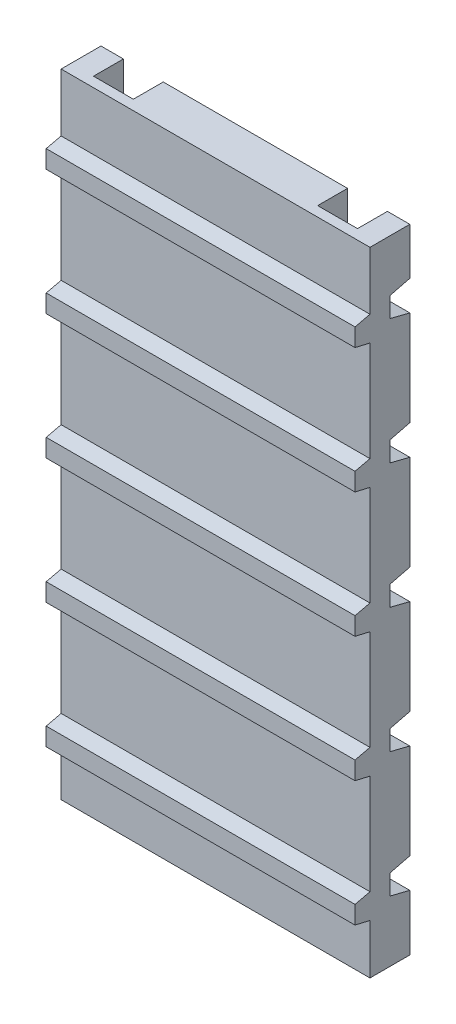
from build123d import *

# Parameters (mm, degrees)
SKETCH2_W                  = 34
SKETCH2_H                  = 13.32
BOSS_EXTRUDE1_DEPTH        = 4
SKETCH3_W                  = 17
SKETCH3_H                  = 7
CUT_EXTRUDE1_DEPTH         = 3
SKETCH4_W                  = 4
SKETCH4_H                  = 13.32
CUT_EXTRUDE3_DEPTH         = 3
CUT_EXTRUDE4_DEPTH         = 4
CUT_EXTRUDE5_DEPTH         = 4
BOSS_EXTRUDE2_DEPTH        = 34
SKETCH9_W                  = 1.5
SKETCH9_H                  = 13.32
CUT_EXTRUDE6_DEPTH         = 10
CRVPATTERN11_START         = -8.5
CRVPATTERN11_OUTLINE_W     = 0.77
CRVPATTERN11_OUTLINE_H     = 3
CRVPATTERN11_DEPTH         = 17
CRVPATTERN11_START_2       = -9.25
CRVPATTERN11_2_DEPTH       = 18.5
CRVPATTERN11_START_3       = -15.5
CRVPATTERN11_3_DEPTH       = 31
CRVPATTERN11_START_4       = 13.25
CRVPATTERN11_4_DEPTH       = 2.25
CRVPATTERN11_5_DEPTH       = 2.25
CRVPATTERN11_6_OUTLINE_W   = 7
CRVPATTERN11_6_OUTLINE_H   = 3
CRVPATTERN11_6_OUTLINE_W_2 = 6.23
CRVPATTERN11_6_DEPTH       = 0.75
CRVPATTERN11_START_5       = 8.5
CRVPATTERN11_7_OUTLINE_W   = 7
CRVPATTERN11_7_OUTLINE_H   = 3
CRVPATTERN11_7_OUTLINE_W_2 = 6.23
CRVPATTERN11_7_DEPTH       = 0.75


with BuildPart() as part:
    # Sketch2 → Boss-Extrude1 (new body)
    with BuildSketch(Plane.XY):
        with Locations((0, 6.66)):
            Rectangle(SKETCH2_W, SKETCH2_H)
    extrude(amount=BOSS_EXTRUDE1_DEPTH)

    # Sketch3 → Cut-Extrude1 (cut)
    with BuildSketch(Plane(origin=(0, 0, 0), x_dir=(-1, 0, 0), z_dir=(0, 0, -1))):
        with Locations((0, 3.5)):
            Rectangle(SKETCH3_W, SKETCH3_H)
    extrude(amount=-CUT_EXTRUDE1_DEPTH, mode=Mode.SUBTRACT)

    # Sketch4 → Cut-Extrude3 (cut)
    with BuildSketch(Plane(origin=(0, 0, 0), x_dir=(-1, 0, 0), z_dir=(0, 0, -1))):
        with Locations((-11.25, 6.66)):
            Rectangle(SKETCH4_W, SKETCH4_H)
        with Locations((11.25, 6.66)):
            Rectangle(SKETCH4_W, SKETCH4_H)
    extrude(amount=-CUT_EXTRUDE3_DEPTH, mode=Mode.SUBTRACT)

    # Sketch6 → Cut-Extrude4 (cut)
    with BuildSketch(Plane(origin=(17, 0, 0), x_dir=(0, 0, -1), z_dir=(1, 0, 0))):
        Polygon((0, 8.62), (0, 5.62), (-2, 6.12), (-2, 8.12), align=None)
    extrude(amount=-CUT_EXTRUDE4_DEPTH, mode=Mode.SUBTRACT)

    # Sketch7 → Cut-Extrude5 (cut)
    with BuildSketch(Plane.ZY.offset(17)):
        Polygon((0, 5.616283946), (0, 8.62), (2, 8.117101335), (2, 6.119182611), align=None)
    extrude(amount=-CUT_EXTRUDE5_DEPTH, mode=Mode.SUBTRACT)

    # Sketch8 → Boss-Extrude2 (add)
    with BuildSketch(Plane.ZY.offset(17)):
        Polygon((4, 5), (4, 7.5), (5.5, 7.15), (5.5, 5.35), align=None)
    extrude(amount=-BOSS_EXTRUDE2_DEPTH)

    # Sketch9 → Cut-Extrude6 (cut)
    with BuildSketch(Plane(origin=(0, 0, 0), x_dir=(-1, 0, 0), z_dir=(0, 0, -1))):
        with Locations((-16.25, 6.66)):
            Rectangle(SKETCH9_W, SKETCH9_H)
        with Locations((16.25, 6.66)):
            Rectangle(SKETCH9_W, SKETCH9_H)
    extrude(amount=-CUT_EXTRUDE6_DEPTH, mode=Mode.SUBTRACT)

    # CrvPattern11: read off the stored shape, not the designer's step
    # CrvPattern11 outline → CrvPattern11 (cut)
    with BuildSketch(Plane.YZ.offset(CRVPATTERN11_START)):
        with Locations((12.935, 1.5)):
            Rectangle(CRVPATTERN11_OUTLINE_W, CRVPATTERN11_OUTLINE_H)
    extrude(amount=CRVPATTERN11_DEPTH, mode=Mode.SUBTRACT)

    # CrvPattern11 2 outline → CrvPattern11 2 (add)
    with BuildSketch(Plane.YZ.offset(CRVPATTERN11_START_2)):
        Polygon((55.2, 4), (45.15, 4), (44.8, 5.5), (43, 5.5), (42.65, 4), (32.6, 4), (32.25, 5.5), (30.45, 5.5), (30.1, 4), (20.05, 4), (19.7, 5.5), (17.9, 5.5), (17.55, 4), (13.32, 4), (13.32, 3), (19.55, 3), (19.55, 0), (25.1, 0), (25.1, 3), (32.1, 3), (32.1, 0), (37.65, 0), (37.65, 3), (44.65, 3), (44.65, 0), (50.2, 0), (50.2, 3), (57.2, 3), (57.2, 0), (63.52, 0), (63.52, 4), (57.7, 4), (57.35, 5.5), (55.55, 5.5), align=None)
    extrude(amount=CRVPATTERN11_2_DEPTH)

    # CrvPattern11 3 outline → CrvPattern11 3 (add)
    with BuildSketch(Plane.YZ.offset(CRVPATTERN11_START_3)):
        Polygon((55.2, 4), (45.15, 4), (44.8, 5.5), (43, 5.5), (42.65, 4), (32.6, 4), (32.25, 5.5), (30.45, 5.5), (30.1, 4), (20.05, 4), (19.7, 5.5), (17.9, 5.5), (17.55, 4), (13.32, 4), (13.32, 3), (63.52, 3), (63.52, 4), (57.7, 4), (57.35, 5.5), (55.55, 5.5), align=None)
    extrude(amount=CRVPATTERN11_3_DEPTH)

    # CrvPattern11 4 outline → CrvPattern11 4 (add)
    with BuildSketch(Plane.YZ.offset(CRVPATTERN11_START_4)):
        Polygon((63.52, 0), (63.52, 3), (13.32, 3), (13.32, 0), (18.17, 0), (18.67, 2), (20.67, 2), (21.17, 0), (30.72, 0), (31.22, 2), (33.22, 2), (33.72, 0), (43.27, 0), (43.77, 2), (45.77, 2), (46.27, 0), (55.82, 0), (56.32, 2), (58.32, 2), (58.82, 0), align=None)
    extrude(amount=CRVPATTERN11_4_DEPTH)

    # CrvPattern11 5 outline → CrvPattern11 5 (add)
    with BuildSketch(Plane.YZ.offset(CRVPATTERN11_START_3)):
        Polygon((63.52, 0), (63.52, 3), (13.32, 3), (13.32, 0), (18.166283946, 0), (18.669182611, 2), (20.667101335, 2), (21.17, 0), (30.716283946, 0), (31.219182611, 2), (33.217101335, 2), (33.72, 0), (43.266283946, 0), (43.769182611, 2), (45.767101335, 2), (46.27, 0), (55.816283946, 0), (56.319182611, 2), (58.317101335, 2), (58.82, 0), align=None)
    extrude(amount=CRVPATTERN11_5_DEPTH)

    # CrvPattern11 6 outline → CrvPattern11 6 (add)
    with BuildSketch(Plane.YZ.offset(CRVPATTERN11_START_2)):
        with Locations((53.7, 1.5)):
            Rectangle(CRVPATTERN11_6_OUTLINE_W, CRVPATTERN11_6_OUTLINE_H)
        with Locations((41.15, 1.5)):
            Rectangle(CRVPATTERN11_6_OUTLINE_W, CRVPATTERN11_6_OUTLINE_H)
        with Locations((28.6, 1.5)):
            Rectangle(CRVPATTERN11_6_OUTLINE_W, CRVPATTERN11_6_OUTLINE_H)
        with Locations((16.435, 1.5)):
            Rectangle(CRVPATTERN11_6_OUTLINE_W_2, CRVPATTERN11_6_OUTLINE_H)
    extrude(amount=CRVPATTERN11_6_DEPTH)

    # CrvPattern11 7 outline → CrvPattern11 7 (add)
    with BuildSketch(Plane.YZ.offset(CRVPATTERN11_START_5)):
        with Locations((53.7, 1.5)):
            Rectangle(CRVPATTERN11_7_OUTLINE_W, CRVPATTERN11_7_OUTLINE_H)
        with Locations((41.15, 1.5)):
            Rectangle(CRVPATTERN11_7_OUTLINE_W, CRVPATTERN11_7_OUTLINE_H)
        with Locations((28.6, 1.5)):
            Rectangle(CRVPATTERN11_7_OUTLINE_W, CRVPATTERN11_7_OUTLINE_H)
        with Locations((16.435, 1.5)):
            Rectangle(CRVPATTERN11_7_OUTLINE_W_2, CRVPATTERN11_7_OUTLINE_H)
    extrude(amount=CRVPATTERN11_7_DEPTH)


solid = part.part
